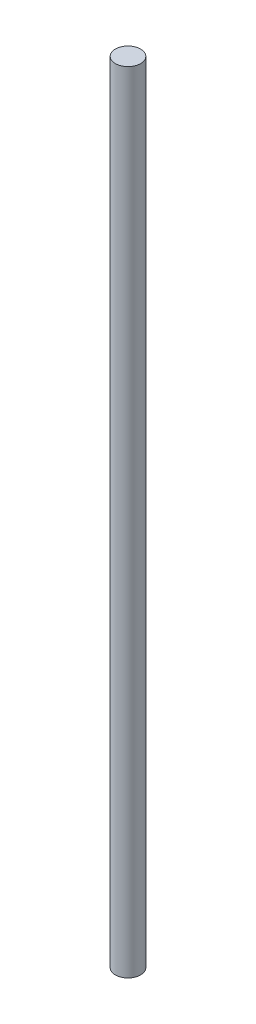
from build123d import *

# Parameters (mm, degrees)
SKETCH1_R           = 3.175
BOSS_EXTRUDE1_DEPTH = 198.575000116


with BuildPart() as part:
    # Sketch1 → Boss-Extrude1 (new body)
    with BuildSketch(Plane(origin=(0, 0, 0), x_dir=(1, 0, 0), z_dir=(0, 1, 0))):
        Circle(SKETCH1_R)
    extrude(amount=BOSS_EXTRUDE1_DEPTH)


solid = part.part
